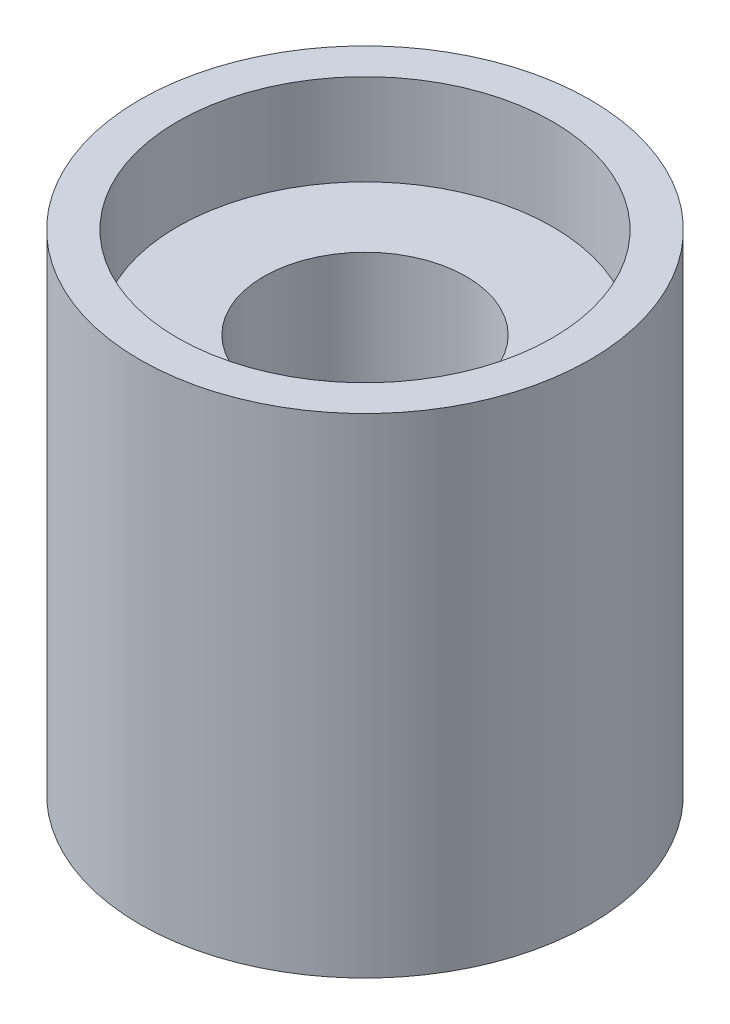
from build123d import *

# Parameters (mm, degrees)
SKETCH1_R           = 22.225
BOSS_EXTRUDE1_DEPTH = 48.26
SKETCH2_R           = 18.5039
CUT_EXTRUDE1_DEPTH  = 8.9916
CUT_EXTRUDE2_START  = -8.9916
SKETCH4_R           = 18.5039
CUT_EXTRUDE2_DEPTH  = 8.9916
SKETCH5_R           = 9.9949
CUT_EXTRUDE3_DEPTH  = 51.298195679


with BuildPart() as part:
    # Sketch1 → Boss-Extrude1 (new body)
    with BuildSketch(Plane(origin=(0, 0, 0), x_dir=(1, 0, 0), z_dir=(0, 1, 0))):
        Circle(SKETCH1_R)
    extrude(amount=BOSS_EXTRUDE1_DEPTH)

    # Sketch2 → Cut-Extrude1 (cut)
    with BuildSketch(Plane(origin=(0, 48.26, 0), x_dir=(1, 0, 0), z_dir=(0, 1, 0))):
        Circle(SKETCH2_R)
    extrude(amount=-CUT_EXTRUDE1_DEPTH, mode=Mode.SUBTRACT)

    # Sketch4 → Cut-Extrude2 (cut)
    with BuildSketch(Plane.XZ.offset(CUT_EXTRUDE2_START)):
        Circle(SKETCH4_R)
    extrude(amount=CUT_EXTRUDE2_DEPTH, mode=Mode.SUBTRACT)

    # Sketch5 → Cut-Extrude3 (cut, through all)
    with BuildSketch(Plane.XZ.offset(-8.9916)):
        Circle(SKETCH5_R)
    extrude(amount=-CUT_EXTRUDE3_DEPTH, mode=Mode.SUBTRACT)


solid = part.part
